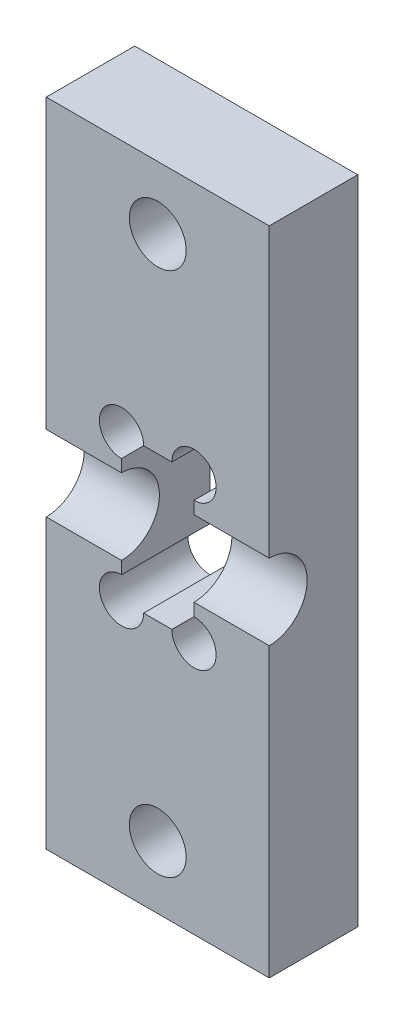
from build123d import *

# Parameters (mm, degrees)
SKETCH1_W           = 20
SKETCH1_H           = 58.42
SKETCH1_R           = 2.55
BOSS_EXTRUDE1_DEPTH = 7.9375
CUT_EXTRUDE1_DEPTH  = 63.256729004


with BuildPart() as part:
    # Sketch1 → Boss-Extrude1 (new body)
    with BuildSketch(Plane.XY):
        with Locations((10, 29.21)):
            Rectangle(SKETCH1_W, SKETCH1_H)
        with Locations((10, 52.78)):
            Circle(SKETCH1_R, mode=Mode.SUBTRACT)
        with Locations((10, 5.64)):
            Circle(SKETCH1_R, mode=Mode.SUBTRACT)
        with BuildLine():
            Line((13.25, 24.694375), (13.25, 33.725625))
            ThreePointArc((13.25, 33.725625), (14.653165019, 37.113165019), (11.265625, 35.71))
            Line((11.265625, 35.71), (8.734375, 35.71))
            ThreePointArc((8.734375, 35.71), (5.346834981, 37.113165019), (6.75, 33.725625))
            Line((6.75, 33.725625), (6.75, 24.694375))
            ThreePointArc((6.75, 24.694375), (5.346834981, 21.306834981), (8.734375, 22.71))
            Line((8.734375, 22.71), (11.265625, 22.71))
            ThreePointArc((11.265625, 22.71), (14.653165019, 21.306834981), (13.25, 24.694375))
        make_face(mode=Mode.SUBTRACT)
    extrude(amount=BOSS_EXTRUDE1_DEPTH)

    # Sketch2 → Cut-Extrude1 (cut, through all)
    with BuildSketch(Plane(origin=(20, 0, 0), x_dir=(0, 0, -1), z_dir=(1, 0, 0))):
        with BuildLine():
            Line((-7.9375, 32.61), (-7.9375, 25.81))
            ThreePointArc((-7.9375, 25.81), (-4.5375, 29.21), (-7.9375, 32.61))
        make_face()
    extrude(amount=-CUT_EXTRUDE1_DEPTH, mode=Mode.SUBTRACT)


solid = part.part
